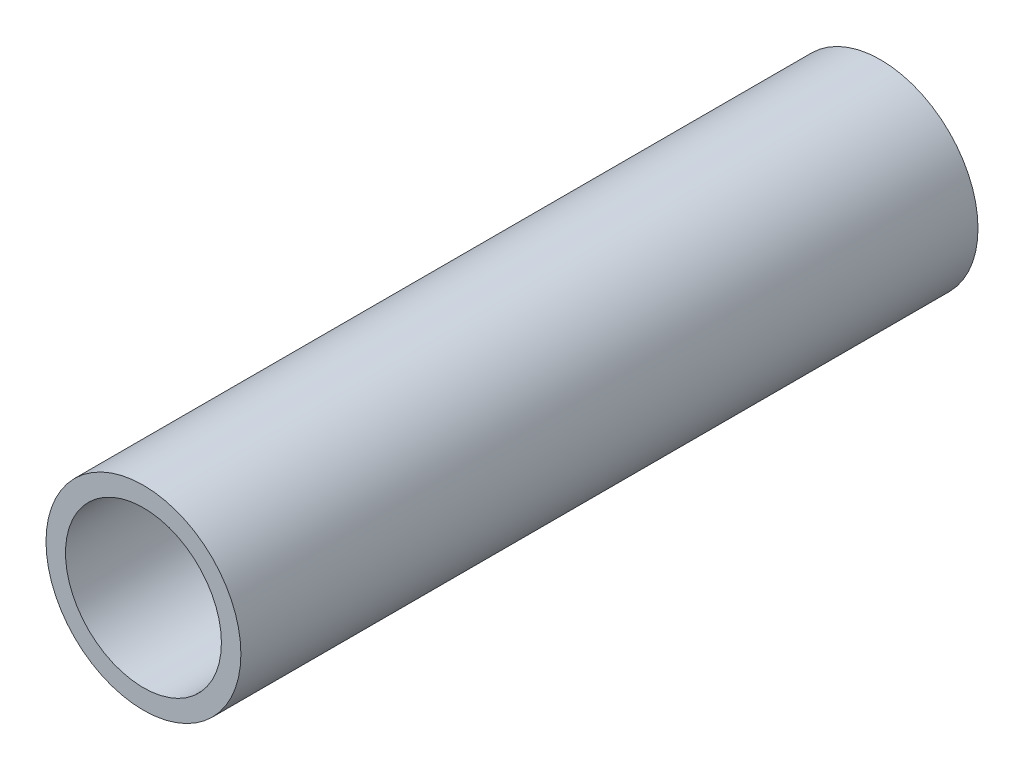
from build123d import *

# Parameters (mm, degrees)
SKETCH1_R           = 1.25
SKETCH1_R_2         = 1
BOSS_EXTRUDE1_DEPTH = 9.455


with BuildPart() as part:
    # Sketch1 → Boss-Extrude1 (new body)
    with BuildSketch(Plane.XY):
        Circle(SKETCH1_R)
        Circle(SKETCH1_R_2, mode=Mode.SUBTRACT)
    extrude(amount=BOSS_EXTRUDE1_DEPTH)


solid = part.part
